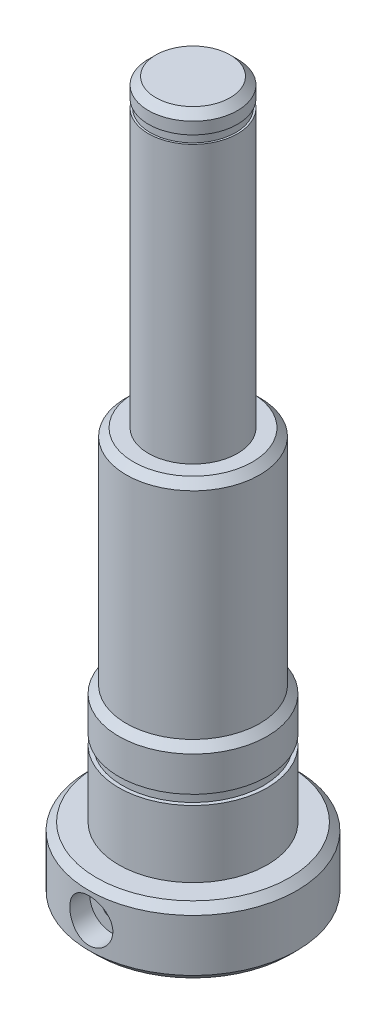
from build123d import *

# Parameters (mm, degrees)
CHAMFER2_SIZE               = 1
CHAMFER7_SIZE               = 1
CHAMFER8_SIZE               = 1
CHAMFER9_SIZE               = 1
SKETCH2_R                   = 5.05
CUT_EXTRUDE1_DEPTH          = 20.5
SKETCH3_R                   = 2.9
CUT_EXTRUDE2_DEPTH          = 3
TAP_DRILL_FOR_M3_TAP1_D     = 2.5
TAP_DRILL_FOR_M3_TAP1_DEPTH = 8
TAP_DRILL_FOR_M3_TAP1_TIP   = 0.751075774


with BuildPart() as part:
    # Sketch1 → Revolve1 (revolve)
    with BuildSketch(Plane.XY, mode=Mode.PRIVATE) as revolve1_sk:
        Polygon((0, 0), (-10, 0), (-14, 0), (-14, 9), (-10, 9), (-10, 18), (-9.5, 18), (-9.5, 19.3), (-10, 19.3), (-10, 25), (-9, 25), (-9, 55), (-6, 55), (-6, 92.3), (-5.75, 92.3), (-5.75, 93.4), (-6, 93.4), (-6, 96), (0, 96), align=None)
    revolve(revolve1_sk.sketch.rotate(Axis((0, 0, 0), (0, 1, 0)), 180), axis=Axis((0, 0, 0), (0, 1, 0)))

    # Chamfer2
    chamfer2_edges = [part.edges().sort_by_distance(p)[0] for p in [
        (-6, 96, 0),
    ]]
    chamfer(chamfer2_edges, length=CHAMFER2_SIZE)

    # Chamfer7
    chamfer7_edges = [part.edges().sort_by_distance(p)[0] for p in [
        (-9, 55, 0),
    ]]
    chamfer(chamfer7_edges, length=CHAMFER7_SIZE)

    # Chamfer8
    chamfer8_edges = [part.edges().sort_by_distance(p)[0] for p in [
        (-10, 25, 0),
    ]]
    chamfer(chamfer8_edges, length=CHAMFER8_SIZE - 0.0001)  # a hair under: the kernel refuses the full size

    # Chamfer9
    chamfer9_edges = [part.edges().sort_by_distance(p)[0] for p in [
        (-14, 9, 0),
        (-14, 0, 0),
    ]]
    chamfer(chamfer9_edges, length=CHAMFER9_SIZE)

    # Sketch2 → Cut-Extrude1 (cut)
    with BuildSketch(Plane.XZ):
        Circle(SKETCH2_R)
    extrude(amount=-CUT_EXTRUDE1_DEPTH, mode=Mode.SUBTRACT)

    # Sketch3 → Cut-Extrude2 (cut)
    with BuildSketch(Plane.XY.offset(14)):
        with Locations((0, 4.5)):
            Circle(SKETCH3_R)
    extrude(amount=-CUT_EXTRUDE2_DEPTH, mode=Mode.SUBTRACT)

    # Tap Drill for M3 Tap1
    with Locations(Plane(origin=(0, 4.5, 11), x_dir=(1, 0, 0), z_dir=(0, 0, 1))):
        with Locations((0, 0)):
            Hole(TAP_DRILL_FOR_M3_TAP1_D / 2, depth=TAP_DRILL_FOR_M3_TAP1_DEPTH)
            with Locations((0, 0, -(TAP_DRILL_FOR_M3_TAP1_DEPTH + TAP_DRILL_FOR_M3_TAP1_TIP / 2))):  # 118° drill point
                Cone(0, TAP_DRILL_FOR_M3_TAP1_D / 2, TAP_DRILL_FOR_M3_TAP1_TIP, mode=Mode.SUBTRACT)


solid = part.part
